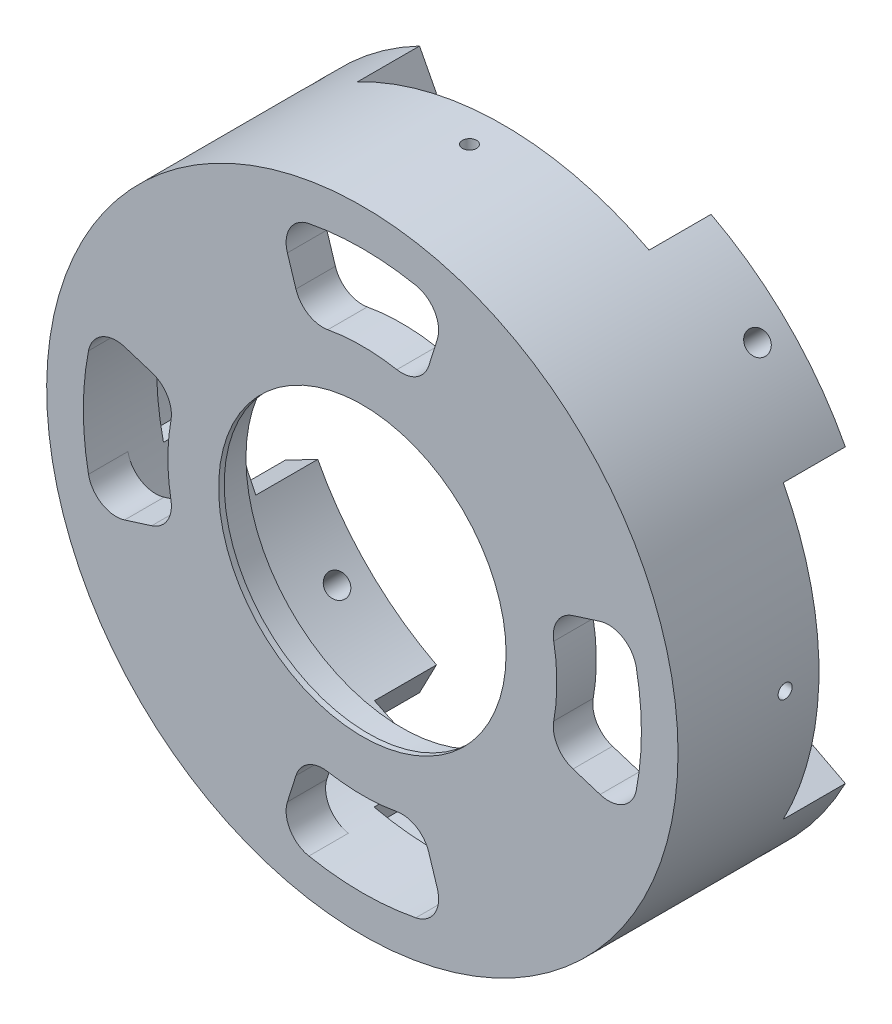
from build123d import *

# Parameters (mm, degrees)
SKETCH1_R               = 56
SKETCH1_R_2             = 54
BOSS_EXTRUDE1_DEPTH     = 52
BOSS_EXTRUDE3_START     = -3
SKETCH3_R               = 54
SKETCH3_R_2             = 27.65
BOSS_EXTRUDE3_DEPTH     = 3
BOSS_EXTRUDE4_START     = -1
SKETCH3_3_R             = 27.65
SKETCH3_3_R_2           = 25.5
BOSS_EXTRUDE4_DEPTH     = 1
BOSS_EXTRUDE5_START     = 4
SKETCH4_R               = 54
SKETCH4_R_2             = 32.65
SKETCH4_R_3             = 27.65
BOSS_EXTRUDE5_DEPTH     = 4
BOSS_EXTRUDE6_START     = 45
SKETCH5_R               = 54
SKETCH5_R_2             = 49.5
BOSS_EXTRUDE6_DEPTH     = 45
CUT_EXTRUDE2_START      = -39
CUT_EXTRUDE2_DEPTH      = 39
SKETCH7_R               = 56
CUT_EXTRUDE4_DEPTH      = 27
BOSS_EXTRUDE7_START     = -36
BOSS_EXTRUDE7_DEPTH     = 11
SKETCH13_R              = 2
CUT_EXTRUDE7_DEPTH      = 11
CIRPATTERN1_COUNT       = 4
CUT_EXTRUDE8_REACH      = 137.588
CUT_EXTRUDE8_END_RADIUS = 53.2
SKETCH14_R              = 1.25
CIRPATTERN2_COUNT       = 4
CUT_EXTRUDE9_REACH      = 88.994
FILLET1_R               = 5
CIRPATTERN3_START       = 45
CIRPATTERN3_DEPTH       = 7


# Read off the part's stored shape, not the designer's step: Cut-Extrude2, CirPattern3
with BuildPart() as part:
    # Sketch1 → Boss-Extrude1 (new body)
    with BuildSketch(Plane.XY):
        with Locations(Location((0, 0, 0), (0, 0, 180))):
            Circle(SKETCH1_R)
        with Locations(Location((0, 0, 0), (0, 0, 180))):
            Circle(SKETCH1_R_2, mode=Mode.SUBTRACT)
    extrude(amount=BOSS_EXTRUDE1_DEPTH)

    # Sketch3 → Boss-Extrude3 (add)
    with BuildSketch(Plane.XY.offset(52).offset(BOSS_EXTRUDE3_START)):
        with Locations(Location((0, 0, 0), (0, 0, 180))):
            Circle(SKETCH3_R)
        Circle(SKETCH3_R_2, mode=Mode.SUBTRACT)
    extrude(amount=BOSS_EXTRUDE3_DEPTH)

    # Sketch3<3> → Boss-Extrude4 (add)
    with BuildSketch(Plane.XY.offset(52).offset(BOSS_EXTRUDE4_START)):
        Circle(SKETCH3_3_R)
        Circle(SKETCH3_3_R_2, mode=Mode.SUBTRACT)
    extrude(amount=BOSS_EXTRUDE4_DEPTH)

    # Sketch4 → Boss-Extrude5 (add)
    # profile 1 of 2: a face of its own
    with BuildSketch(Plane(origin=(0, 0, 49), x_dir=(-1, 0, 0), z_dir=(0, 0, -1)).offset(BOSS_EXTRUDE5_START)):
        Circle(SKETCH4_R)
        Circle(SKETCH4_R_2, mode=Mode.SUBTRACT)
    # profile 2 of 2: a face of its own
    with BuildSketch(Plane(origin=(0, 0, 49), x_dir=(-1, 0, 0), z_dir=(0, 0, -1)).offset(BOSS_EXTRUDE5_START)):
        Circle(SKETCH4_R_2)
        with Locations(Location((0, 0, 0), (0, 0, 180))):
            Circle(SKETCH4_R_3, mode=Mode.SUBTRACT)
    extrude(amount=-BOSS_EXTRUDE5_DEPTH)

    # Sketch5 → Boss-Extrude6 (add)
    with BuildSketch(Plane(origin=(0, 0, 45), x_dir=(-1, 0, 0), z_dir=(0, 0, -1)).offset(BOSS_EXTRUDE6_START)):
        Circle(SKETCH5_R)
        with Locations(Location((0, 0, 0), (0, 0, 180))):
            Circle(SKETCH5_R_2, mode=Mode.SUBTRACT)
    extrude(amount=-BOSS_EXTRUDE6_DEPTH)

    # Cut-Extrude2 outline → Cut-Extrude2 (cut)
    with BuildSketch(Plane(origin=(0, 0, 0), x_dir=(-1, 0, 0), z_dir=(0, 0, -1)).offset(CUT_EXTRUDE2_START)):
        with BuildLine():
            Line((10.924523034, 48.279444865), (11.741103543, 51.888211451))
            ThreePointArc((11.741103543, 51.888211451), (0, 53.2), (-11.741103543, 51.888211451))
            Line((-11.741103543, 51.888211451), (-10.924523034, 48.279444865))
            ThreePointArc((-10.924523034, 48.279444865), (0, 49.5), (10.924523034, 48.279444865))
        make_face()
        with BuildLine():
            Line((51.888211451, 11.741103543), (48.279444865, 10.924523034))
            ThreePointArc((48.279444865, 10.924523034), (49.5, 0), (48.279444865, -10.924523034))
            Line((48.279444865, -10.924523034), (51.888211451, -11.741103543))
            ThreePointArc((51.888211451, -11.741103543), (53.2, 0), (51.888211451, 11.741103543))
        make_face()
        with BuildLine():
            ThreePointArc((-48.279444865, -10.924523034), (-49.5, 0), (-48.279444865, 10.924523034))
            Line((-48.279444865, 10.924523034), (-51.888211451, 11.741103543))
            ThreePointArc((-51.888211451, 11.741103543), (-53.2, 0), (-51.888211451, -11.741103543))
            Line((-51.888211451, -11.741103543), (-48.279444865, -10.924523034))
        make_face()
        with BuildLine():
            ThreePointArc((10.924523034, -48.279444865), (0, -49.5), (-10.924523034, -48.279444865))
            Line((-10.924523034, -48.279444865), (-11.741103543, -51.888211451))
            ThreePointArc((-11.741103543, -51.888211451), (0, -53.2), (11.741103543, -51.888211451))
            Line((11.741103543, -51.888211451), (10.924523034, -48.279444865))
        make_face()
    extrude(amount=CUT_EXTRUDE2_DEPTH, mode=Mode.SUBTRACT)

    # Sketch7 → Cut-Extrude4 (cut)
    with BuildSketch(Plane(origin=(0, 0, 0), x_dir=(-1, 0, 0), z_dir=(0, 0, -1))):
        Circle(SKETCH7_R)
    extrude(amount=-CUT_EXTRUDE4_DEPTH, mode=Mode.SUBTRACT)

    # Sketch9 → Boss-Extrude7 (add)
    with BuildSketch(Plane.XY.offset(52).offset(BOSS_EXTRUDE7_START)):
        with BuildLine():
            ThreePointArc((-25.857922341, 49.672606658), (-39.597979746, 39.597979746), (-49.672606658, 25.857922341))
            Line((-49.672606658, 25.857922341), (-43.907036242, 22.856556355))
            ThreePointArc((-43.907036242, 22.856556355), (-35.001785669, 35.001785669), (-22.856556355, 43.907036242))
            Line((-22.856556355, 43.907036242), (-25.857922341, 49.672606658))
        make_face()
        with BuildLine():
            ThreePointArc((49.672606658, 25.857922341), (39.597979746, 39.597979746), (25.857922341, 49.672606658))
            Line((25.857922341, 49.672606658), (22.856556355, 43.907036242))
            ThreePointArc((22.856556355, 43.907036242), (35.001785669, 35.001785669), (43.907036242, 22.856556355))
            Line((43.907036242, 22.856556355), (49.672606658, 25.857922341))
        make_face()
        with BuildLine():
            Line((22.856556355, -43.907036242), (25.857922341, -49.672606658))
            ThreePointArc((25.857922341, -49.672606658), (39.597979746, -39.597979746), (49.672606658, -25.857922341))
            Line((49.672606658, -25.857922341), (43.907036242, -22.856556355))
            ThreePointArc((43.907036242, -22.856556355), (35.001785669, -35.001785669), (22.856556355, -43.907036242))
        make_face()
        with BuildLine():
            Line((-43.907036242, -22.856556355), (-49.672606658, -25.857922341))
            ThreePointArc((-49.672606658, -25.857922341), (-39.597979746, -39.597979746), (-25.857922341, -49.672606658))
            Line((-25.857922341, -49.672606658), (-22.856556355, -43.907036242))
            ThreePointArc((-22.856556355, -43.907036242), (-35.001785669, -35.001785669), (-43.907036242, -22.856556355))
        make_face()
    extrude(amount=BOSS_EXTRUDE7_DEPTH)

    # Sketch13 → Cut-Extrude7 (cut)
    with BuildSketch(Plane(origin=(-39.597979746, 39.597979746, 0), x_dir=(0, 0, 1), z_dir=(-0.7071067811865488, 0.7071067811865464, 0))):
        with Locations(Location((21.5, 0, 0), (0, 0, 270))):
            Circle(SKETCH13_R)
    cut_extrude7 = extrude(amount=-CUT_EXTRUDE7_DEPTH, mode=Mode.SUBTRACT)

    # CirPattern1: Cut-Extrude7 ×4 about axis
    cirpattern1_axis = Axis((0, 0, 0), (0, 0, -1))
    for i in range(1, CIRPATTERN1_COUNT):
        add(cut_extrude7.rotate(cirpattern1_axis, i * 360 / CIRPATTERN1_COUNT), mode=Mode.SUBTRACT)

    # Cut-Extrude8: up to this cylinder (the profile starts outside it)
    cut_extrude8_end = Plane(origin=(0, 0, 33), z_dir=(0, 0, -1)) * Cylinder(CUT_EXTRUDE8_END_RADIUS, 382.576, mode=Mode.PRIVATE)
    # Sketch14 → Cut-Extrude8 (cut, up to the surface)
    with BuildSketch(Plane(origin=(0, 56, 0), x_dir=(1, 0, 0), z_dir=(0, 1, 0)), mode=Mode.PRIVATE) as cut_extrude8_sk1:
        with Locations(Location((0, -33, 0), (0, 0, 270))):
            Circle(SKETCH14_R)
    cut_extrude8_tool1 = extrude(cut_extrude8_sk1.sketch, amount=-CUT_EXTRUDE8_REACH, mode=Mode.PRIVATE) - cut_extrude8_end
    cut_extrude8 = cut_extrude8_tool1.solids().sort_by_distance((0, 56, 33))[0]
    add(cut_extrude8, mode=Mode.SUBTRACT)

    # CirPattern2: Cut-Extrude8 ×4 about axis
    cirpattern2_axis = Axis((0, 0, 0), (0, 0, -1))
    for i in range(1, CIRPATTERN2_COUNT):
        add(cut_extrude8.rotate(cirpattern2_axis, i * 360 / CIRPATTERN2_COUNT), mode=Mode.SUBTRACT)

    # Sketch15 → Cut-Extrude9 (cut, up to next)
    with BuildSketch(Plane.XY.offset(52), mode=Mode.PRIVATE) as cut_extrude9_sk1:
        with BuildLine():
            Line((-14.884937075, 47.208989062), (-10.374350083, 32.903234801))
            ThreePointArc((-10.374350083, 32.903234801), (0, 34.5), (10.374350083, 32.903234801))
            Line((10.374350083, 32.903234801), (14.884937075, 47.208989062))
            ThreePointArc((14.884937075, 47.208989062), (0, 49.5), (-14.884937075, 47.208989062))
        make_face()
    cut_extrude9_tool1 = extrude(cut_extrude9_sk1.sketch, amount=-CUT_EXTRUDE9_REACH, mode=Mode.PRIVATE) & part.part
    add(cut_extrude9_tool1.solids().sort_by_distance((0, 41.789535, 52))[0], mode=Mode.SUBTRACT)

    # Fillet1
    # the kernel refuses this fillet: 5 mm, written as the material it adds along each edge
    with BuildSketch(Plane(origin=(-14.884937075, 47.208989062, 52), x_dir=(0.3007057995042732, -0.9537169507482269, 0), z_dir=(0, 0, -1))) as fillet1_piece_1:
        with BuildLine():
            CenterArc((5.281791081, -5), FILLET1_R, 90, 96.45135127)
            ThreePointArc((0.313453, -5.561797753), (0.078425377, -2.785311788), (0, 0))
            Line((0, 0), (5.281791081, 0))
        make_face()
    extrude(amount=7)
    with BuildSketch(Plane(origin=(14.884937075, 47.208989062, 52), x_dir=(-0.3007057995042737, -0.9537169507482267, 0), z_dir=(0, 0, -1))) as fillet1_piece_2:
        with BuildLine():
            CenterArc((5.281791081, 5), FILLET1_R, 173.54864873, 96.45135127)
            ThreePointArc((0.313453, 5.561797753), (0.078425377, 2.785311788), (0, 0))
            Line((0, 0), (5.281791081, 0))
        make_face()
    extrude(amount=7)
    with BuildSketch(Plane(origin=(10.374350083, 32.903234801, 52), x_dir=(-0.9708675215045348, 0.2396168935773136, 0), z_dir=(0, 0, -1))) as fillet1_piece_3:
        with BuildLine():
            CenterArc((4.692991287, 4.989935009), FILLET1_R, 183.636069777, 82.727860445)
            Line((-0.296943722, 4.672841003), (0, 0))
            ThreePointArc((0, 0), (2.187948641, 0.06944844), (4.375897281, 0))
        make_face()
    extrude(amount=7)
    with BuildSketch(Plane(origin=(-10.374350083, 32.903234801, 52), x_dir=(-0.30070579950427395, 0.9537169507482266, 0), z_dir=(0, 0, -1))) as fillet1_piece_4:
        with BuildLine():
            CenterArc((4.682266397, 5), FILLET1_R, 187.272139555, 82.727860445)
            ThreePointArc((-0.27751416, 4.367088608), (-0.06944844, 2.187948641), (0, 0))
            Line((0, 0), (4.682266397, 0))
        make_face()
    extrude(amount=7)

    # CirPattern3 outline → CirPattern3 (cut)
    with BuildSketch(Plane.XY.offset(CIRPATTERN3_START)):
        with BuildLine():
            ThreePointArc((48.582508462, -9.486299147), (49.5, 0), (48.582508462, 9.486299147))
            ThreePointArc((48.582508462, 9.486299147), (46.229825312, 12.826204105), (42.171655378, 13.296671866))
            Line((42.171655378, 13.296671866), (37.368791631, 11.782334743))
            ThreePointArc((37.368791631, 11.782334743), (34.592611937, 9.599111378), (33.951773714, 6.125933535))
            ThreePointArc((33.951773714, 6.125933535), (34.5, 0), (33.951773714, -6.125933535))
            ThreePointArc((33.951773714, -6.125933535), (34.592611937, -9.599111378), (37.368791631, -11.782334743))
            Line((37.368791631, -11.782334743), (42.171655378, -13.296671866))
            ThreePointArc((42.171655378, -13.296671866), (46.229825312, -12.826204105), (48.582508462, -9.486299147))
        make_face()
        with BuildLine():
            ThreePointArc((-42.171655378, 13.296671866), (-46.229825312, 12.826204105), (-48.582508462, 9.486299147))
            ThreePointArc((-48.582508462, 9.486299147), (-49.5, 0), (-48.582508462, -9.486299147))
            ThreePointArc((-48.582508462, -9.486299147), (-46.229825312, -12.826204105), (-42.171655378, -13.296671866))
            Line((-42.171655378, -13.296671866), (-37.368791631, -11.782334743))
            ThreePointArc((-37.368791631, -11.782334743), (-34.592611937, -9.599111378), (-33.951773714, -6.125933535))
            ThreePointArc((-33.951773714, -6.125933535), (-34.5, 0), (-33.951773714, 6.125933535))
            ThreePointArc((-33.951773714, 6.125933535), (-34.592611937, 9.599111378), (-37.368791631, 11.782334743))
            Line((-37.368791631, 11.782334743), (-42.171655378, 13.296671866))
        make_face()
        with BuildLine():
            ThreePointArc((-9.486299147, -48.582508462), (0, -49.5), (9.486299147, -48.582508462))
            ThreePointArc((9.486299147, -48.582508462), (12.826204105, -46.229825312), (13.296671866, -42.171655378))
            Line((13.296671866, -42.171655378), (11.782334743, -37.368791631))
            ThreePointArc((11.782334743, -37.368791631), (9.599111378, -34.592611937), (6.125933535, -33.951773714))
            ThreePointArc((6.125933535, -33.951773714), (0, -34.5), (-6.125933535, -33.951773714))
            ThreePointArc((-6.125933535, -33.951773714), (-9.599111378, -34.592611937), (-11.782334743, -37.368791631))
            Line((-11.782334743, -37.368791631), (-13.296671866, -42.171655378))
            ThreePointArc((-13.296671866, -42.171655378), (-12.826204105, -46.229825312), (-9.486299147, -48.582508462))
        make_face()
    extrude(amount=CIRPATTERN3_DEPTH, mode=Mode.SUBTRACT)


solid = part.part
